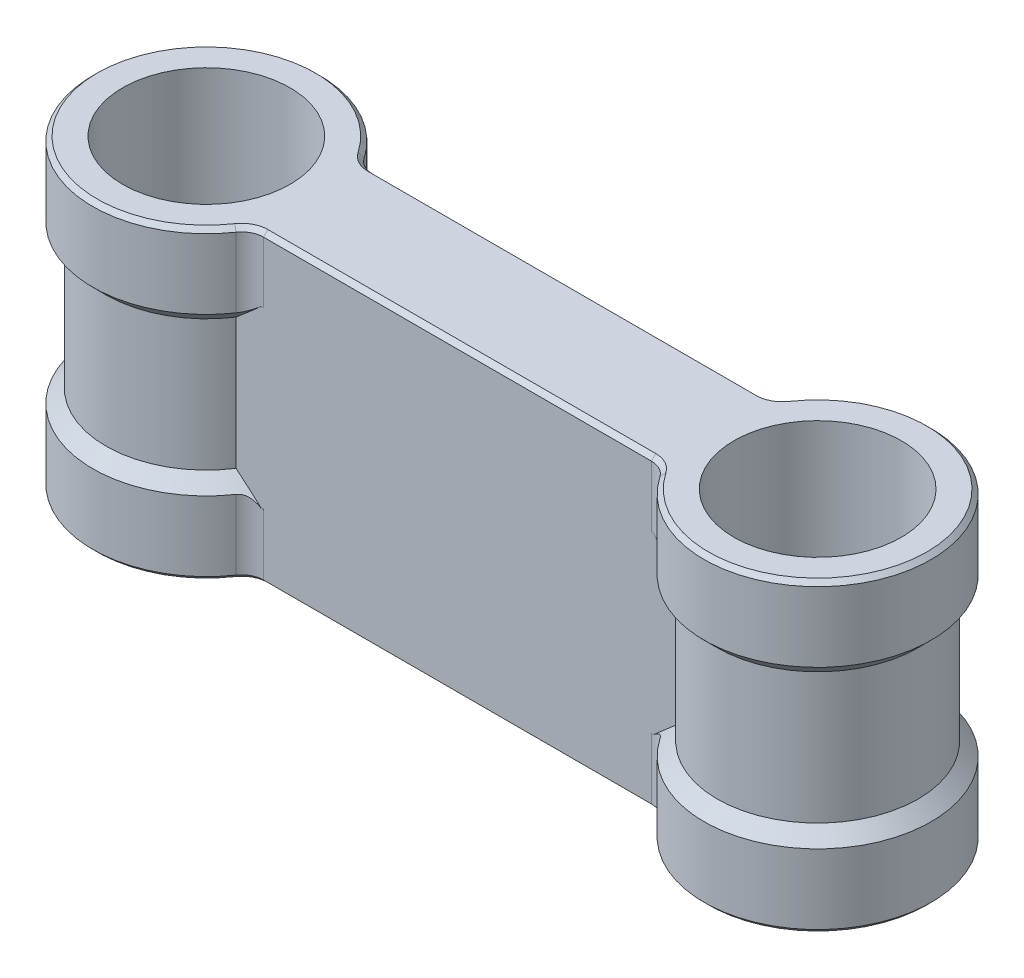
from build123d import *

# Parameters (mm, degrees)
SKETCH1_R            = 19.175
BOSS_EXTRUDE1_DEPTH  = 70
SKETCH3_R            = 26
SKETCH3_R_2          = 19.175
BOSS_EXTRUDE2_DEPTH  = 15
FILLET1_R            = 5
CHAMFER2_START       = 15
CHAMFER2_3_OUTLINE_W = 198
CHAMFER2_3_OUTLINE_H = 58
CHAMFER2_3_DEPTH     = 5
CHAMFER1_SIZE        = 1


with BuildPart() as part:
    # Sketch1 → Boss-Extrude1 (new body)
    with BuildSketch(Plane(origin=(0, 0, 0), x_dir=(1, 0, 0), z_dir=(0, 1, 0))):
        with BuildLine():
            Line((19.306734576, -12.5), (120.693265424, -12.5))
            ThreePointArc((120.693265424, -12.5), (129.011369512, -20.205197351), (140, -23))
            ThreePointArc((140, -23), (163, 0), (140, 23))
            ThreePointArc((140, 23), (129.011369512, 20.205197351), (120.693265424, 12.5))
            Line((120.693265424, 12.5), (19.306734576, 12.5))
            ThreePointArc((19.306734576, 12.5), (10.988630488, 20.205197351), (0, 23))
            ThreePointArc((0, 23), (-23, 0), (0, -23))
            ThreePointArc((0, -23), (10.988630488, -20.205197351), (19.306734576, -12.5))
        make_face()
        with Locations(Location((0, 0, 0), (0, 0, 270))):
            Circle(SKETCH1_R, mode=Mode.SUBTRACT)
        with Locations(Location((140, 0, 0), (0, 0, 270))):
            Circle(SKETCH1_R, mode=Mode.SUBTRACT)
    extrude(amount=BOSS_EXTRUDE1_DEPTH)

    # Sketch3 → Boss-Extrude2 (add)
    # profile 1 of 2: a face of its own
    with BuildSketch(Plane.XZ):
        Circle(SKETCH3_R)
        with Locations(Location((0, 0, 0), (0, 0, 90))):
            Circle(SKETCH3_R_2, mode=Mode.SUBTRACT)
    # profile 2 of 2: a face of its own
    with BuildSketch(Plane.XZ):
        with Locations((140, 0)):
            Circle(SKETCH3_R)
        with Locations(Location((140, 0, 0), (0, 0, 90))):
            Circle(SKETCH3_R_2, mode=Mode.SUBTRACT)
    extrude(amount=-BOSS_EXTRUDE2_DEPTH)

    # Fillet1
    fillet1_edges = [part.edges().sort_by_distance(p)[0] for p in [
        (22.79802623, 7.5, -12.5),
        (22.79802623, 7.5, 12.5),
        (117.20197377, 7.5, -12.5),
        (117.20197377, 7.5, 12.5),
    ]]
    fillet(fillet1_edges, radius=FILLET1_R)

    # Chamfer2: read off the stored shape, not the designer's step
    # Chamfer2 outline → Chamfer2 (revolve)
    with BuildSketch(Plane.XY):
        Polygon((28, 15), (23, 20), (23, 15), align=None)
    revolve(axis=Axis((0, 0, 0), (0, 1, 0)))

    # Chamfer2 2 outline → Chamfer2 2 (revolve)
    with BuildSketch(Plane(origin=(140, 0, 0), x_dir=(1, 0, 0), z_dir=(0, 0, 1))):
        Polygon((28, 15), (23, 20), (23, 15), align=None)
    revolve(axis=Axis((140, 0, 0), (0, 1, 0)))

    # Chamfer2 3 outline → Chamfer2 3 (cut)
    with BuildSketch(Plane(origin=(0, 0, 0), x_dir=(1, 0, 0), z_dir=(0, 1, 0)).offset(CHAMFER2_START)):
        with Locations((70, 0)):
            Rectangle(CHAMFER2_3_OUTLINE_W, CHAMFER2_3_OUTLINE_H)
        with BuildLine():
            ThreePointArc((25.588083164, -12.5), (23.254941851, -13.0777323), (21.460972976, -14.677419355))
            ThreePointArc((21.460972976, -14.677419355), (-26, 0), (21.460972976, 14.677419355))
            ThreePointArc((21.460972976, 14.677419355), (23.254941851, 13.0777323), (25.588083164, 12.5))
            Line((25.588083164, 12.5), (114.411916836, 12.5))
            ThreePointArc((114.411916836, 12.5), (116.745058149, 13.0777323), (118.539027024, 14.677419355))
            ThreePointArc((118.539027024, 14.677419355), (166, 0), (118.539027024, -14.677419355))
            ThreePointArc((118.539027024, -14.677419355), (116.745058149, -13.0777323), (114.411916836, -12.5))
            Line((114.411916836, -12.5), (25.588083164, -12.5))
        make_face(mode=Mode.SUBTRACT)
    extrude(amount=CHAMFER2_3_DEPTH, mode=Mode.SUBTRACT)

    # Mirror1: read off the stored shape, not the designer's step
    # Mirror1: part across plane


with BuildPart() as part_1:
    add(part.part)
    add(part.part.mirror(Plane(origin=(0, 35, 0), x_dir=(0, 0, 1), z_dir=(0, -1, 0))))

    # Chamfer1
    chamfer1_edges = [part_1.edges().sort_by_distance(p)[0] for p in [
        (166, 70, 0),
        (70, 70, -12.5),
        (70, 70, 12.5),
        (-26, 70, 0),
        (116.745058149, 70, -13.0777323),
        (116.745058149, 70, 13.0777323),
        (23.254941851, 70, -13.0777323),
        (23.254941851, 70, 13.0777323),
        (70, 0, -12.5),
        (166, 0, 0),
        (70, 0, 12.5),
        (-26, 0, 0),
        (116.745058149, 0, -13.0777323),
        (116.745058149, 0, 13.0777323),
        (23.254941851, 0, -13.0777323),
        (23.254941851, 0, 13.0777323),
    ]]
    chamfer(chamfer1_edges, length=CHAMFER1_SIZE)


solid = part_1.part
